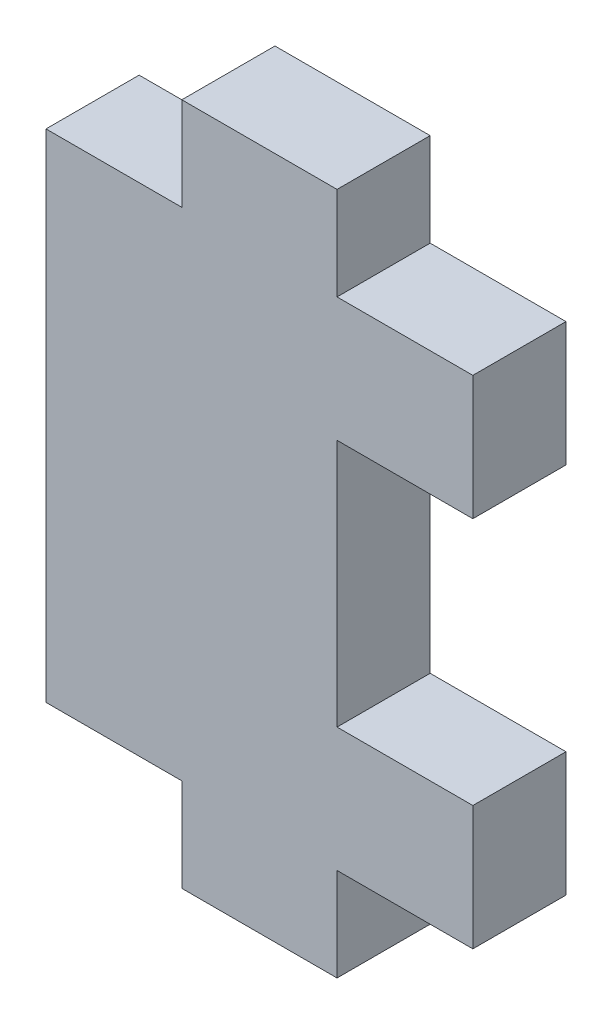
from build123d import *

# Parameters (mm, degrees)
RESSALTO_EXTRUS_O1_DEPTH = 6


with BuildPart() as part:
    # Esboço1 → Ressalto-extrusão1 (new body)
    with BuildSketch(Plane.XY):
        Polygon((-13.75, 16), (-13.75, -16), (-5, -16), (-5, -22), (5, -22), (5, -16), (13.75, -16), (13.75, -8), (5, -8), (5, 8), (13.75, 8), (13.75, 16), (5, 16), (5, 22), (-5, 22), (-5, 16), align=None)
    extrude(amount=RESSALTO_EXTRUS_O1_DEPTH)


solid = part.part
